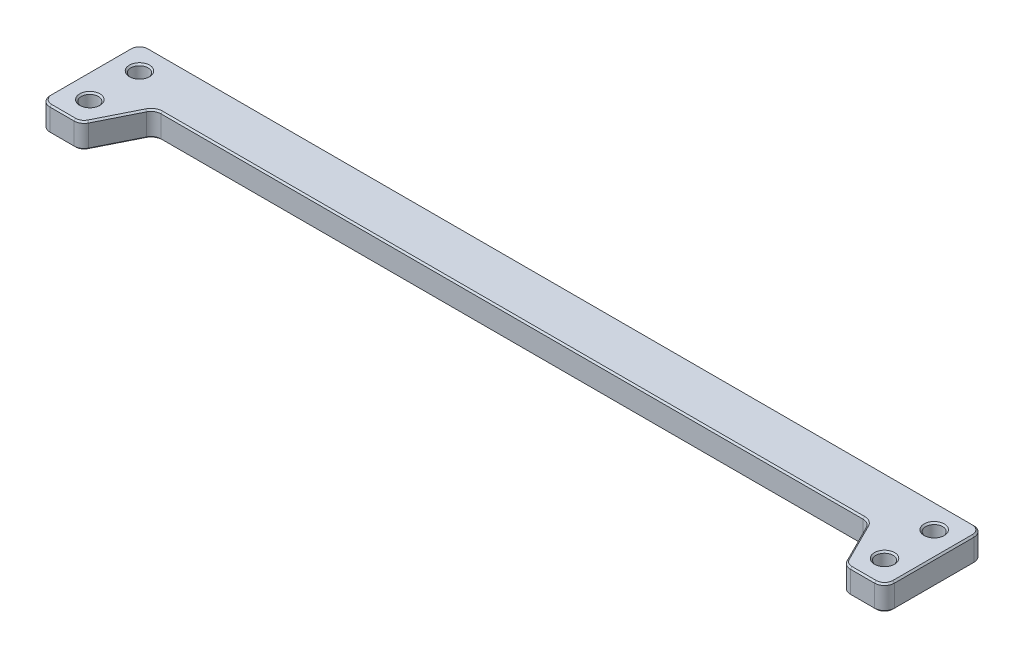
from build123d import *

# Parameters (mm, degrees)
SKETCH1_R           = 2.1828125
BOSS_EXTRUDE1_DEPTH = 3.175
CHAMFER1_SIZE       = 0.396875


with BuildPart() as part:
    # Sketch1 → Boss-Extrude1 (new, symmetric)
    with BuildSketch(Plane(origin=(0, 0, 0), x_dir=(1, 0, 0), z_dir=(0, 1, 0))):
        with BuildLine():
            Line((-3.81, 6.35), (207.01, 6.35))
            ThreePointArc((207.01, 6.35), (208.806051224, 5.606051224), (209.55, 3.81))
            Line((209.55, 3.81), (209.55, -16.51))
            ThreePointArc((209.55, -16.51), (208.806051224, -18.306051224), (207.01, -19.05))
            Line((207.01, -19.05), (200.845290503, -19.05))
            ThreePointArc((200.845290503, -19.05), (199.509933478, -18.670653053), (198.573445438, -17.645922533))
            Line((198.573445438, -17.645922533), (193.627522905, -7.754077467))
            ThreePointArc((193.627522905, -7.754077467), (192.691034865, -6.729346947), (191.35567784, -6.35))
            Line((191.35567784, -6.35), (11.84432216, -6.35))
            ThreePointArc((11.84432216, -6.35), (10.508965135, -6.729346947), (9.572477095, -7.754077467))
            Line((9.572477095, -7.754077467), (4.626554562, -17.645922533))
            ThreePointArc((4.626554562, -17.645922533), (3.690066522, -18.670653053), (2.354709497, -19.05))
            Line((2.354709497, -19.05), (-3.81, -19.05))
            ThreePointArc((-3.81, -19.05), (-5.606051224, -18.306051224), (-6.35, -16.51))
            Line((-6.35, -16.51), (-6.35, 3.81))
            ThreePointArc((-6.35, 3.81), (-5.606051224, 5.606051224), (-3.81, 6.35))
        make_face()
        Circle(SKETCH1_R, mode=Mode.SUBTRACT)
        with Locations((0, -12.7)):
            Circle(SKETCH1_R, mode=Mode.SUBTRACT)
        with Locations((203.2, 0)):
            Circle(SKETCH1_R, mode=Mode.SUBTRACT)
        with Locations((203.2, -12.7)):
            Circle(SKETCH1_R, mode=Mode.SUBTRACT)
    extrude(amount=BOSS_EXTRUDE1_DEPTH, both=True)

    # Chamfer1
    chamfer1_edges = [part.edges().sort_by_distance(p)[0] for p in [
        (201.0171875, -3.175, 12.7),
        (-2.1828125, -3.175, 12.7),
        (101.6, -3.175, -6.35),
        (-5.606051224, -3.175, -5.606051224),
        (-6.35, -3.175, 6.35),
        (-5.606051224, -3.175, 18.306051224),
        (-0.727645251, -3.175, 19.05),
        (3.690066522, -3.175, 18.670653053),
        (7.099515829, -3.175, 12.7),
        (10.508965135, -3.175, 6.729346947),
        (101.6, -3.175, 6.35),
        (192.691034865, -3.175, 6.729346947),
        (196.100484171, -3.175, 12.7),
        (199.509933478, -3.175, 18.670653053),
        (203.927645251, -3.175, 19.05),
        (208.806051224, -3.175, 18.306051224),
        (209.55, -3.175, 6.35),
        (208.806051224, -3.175, -5.606051224),
        (-2.1828125, -3.175, 0),
        (201.0171875, -3.175, 0),
        (201.0171875, 3.175, 12.7),
        (201.0171875, 3.175, 0),
        (-2.1828125, 3.175, 12.7),
        (-2.1828125, 3.175, 0),
        (209.55, 3.175, 6.35),
        (208.806051224, 3.175, 18.306051224),
        (203.927645251, 3.175, 19.05),
        (199.509933478, 3.175, 18.670653053),
        (196.100484171, 3.175, 12.7),
        (192.691034865, 3.175, 6.729346947),
        (101.6, 3.175, 6.35),
        (10.508965135, 3.175, 6.729346947),
        (7.099515829, 3.175, 12.7),
        (3.690066522, 3.175, 18.670653053),
        (-0.727645251, 3.175, 19.05),
        (-5.606051224, 3.175, 18.306051224),
        (-6.35, 3.175, 6.35),
        (-5.606051224, 3.175, -5.606051224),
        (101.6, 3.175, -6.35),
        (208.806051224, 3.175, -5.606051224),
    ]]
    chamfer(chamfer1_edges, length=CHAMFER1_SIZE)


solid = part.part
